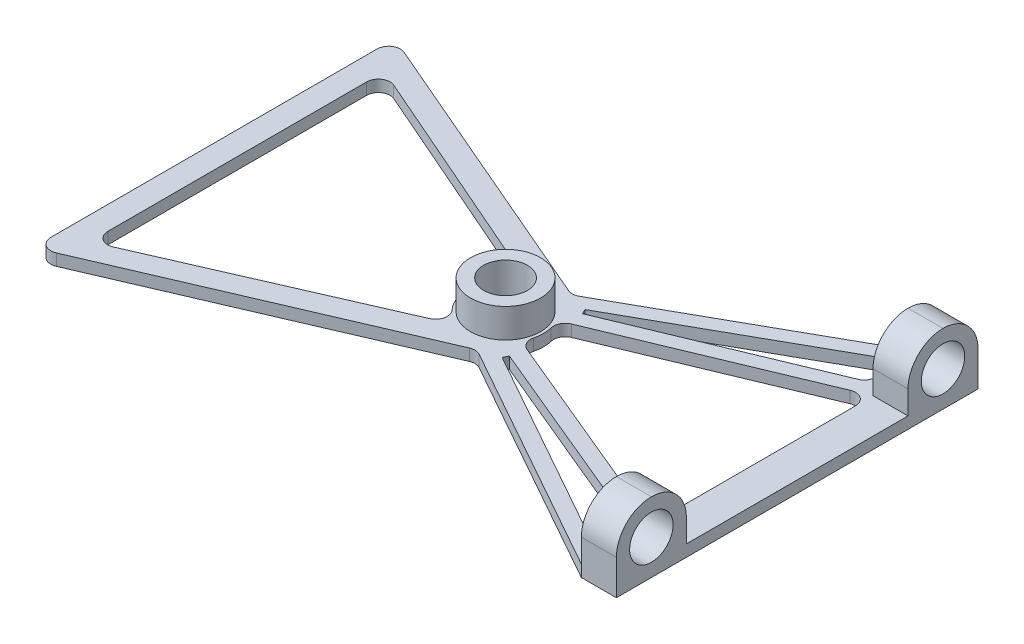
from build123d import *

# Parameters (mm, degrees)
SKETCH_1_W          = 100
SKETCH_1_H          = 100
EXTRUDE_1_DEPTH     = 2
SKETCH_2_W          = 6
SKETCH_2_H          = 12
EXTRUDE_2_DEPTH     = 10
SKETCH_3_R          = 3.725
CUT_EXTRUDE_1_DEPTH = 142.929559994
SKETCH_4_R          = 6
EXTRUDE_3_DEPTH     = 5
SKETCH_5_R          = 3.75
CUT_EXTRUDE_2_DEPTH = 142.594491418
SKETCH_6_W          = 100
SKETCH_6_H          = 19
CUT_EXTRUDE_3_DEPTH = 142.774468788
CUT_EXTRUDE_4_DEPTH = 130.077496102
FILLET_1_R          = 6
CUT_EXTRUDE_6_DEPTH = 130.077496102
FILLET_2_R          = 2
FILLET_3_R          = 2


# Some blends are built 0.0001 mm under size
with BuildPart() as part:
    # 草图1 → 凸台-拉伸1 (new body)
    with BuildSketch(Plane(origin=(0, 0, 0), x_dir=(1, 0, 0), z_dir=(0, 1, 0))):
        with Locations((50, -50)):
            Rectangle(SKETCH_1_W, SKETCH_1_H)
    extrude(amount=EXTRUDE_1_DEPTH)

    # 草图2 → 凸台-拉伸2 (add)
    with BuildSketch(Plane(origin=(0, 2, 0), x_dir=(1, 0, 0), z_dir=(0, 1, 0))):
        with Locations((97, -25)):
            Rectangle(SKETCH_2_W, SKETCH_2_H)
        with Locations((97, -75)):
            Rectangle(SKETCH_2_W, SKETCH_2_H)
    extrude(amount=EXTRUDE_2_DEPTH)

    # 草图3 → 切除-拉伸1 (cut, through all)
    with BuildSketch(Plane(origin=(100, 0, 0), x_dir=(0, 0, -1), z_dir=(1, 0, 0))):
        with Locations((-25, 6)):
            Circle(SKETCH_3_R)
        with Locations((-75, 6)):
            Circle(SKETCH_3_R)
    extrude(amount=-CUT_EXTRUDE_1_DEPTH, mode=Mode.SUBTRACT)

    # 草图4 → 凸台-拉伸3 (add)
    with BuildSketch(Plane(origin=(0, 2, 0), x_dir=(1, 0, 0), z_dir=(0, 1, 0))):
        with Locations(Location((50, -50, 0), (0, 0, 270))):
            Circle(SKETCH_4_R)
    extrude(amount=EXTRUDE_3_DEPTH)

    # 草图5 → 切除-拉伸2 (cut, through all)
    with BuildSketch(Plane(origin=(0, 7, 0), x_dir=(1, 0, 0), z_dir=(0, 1, 0))):
        with Locations(Location((50, -50, 0), (0, 0, 270))):
            Circle(SKETCH_5_R)
    extrude(amount=-CUT_EXTRUDE_2_DEPTH, mode=Mode.SUBTRACT)

    # 草图6 → 切除-拉伸3 (cut, through all)
    with BuildSketch(Plane(origin=(0, 2, 0), x_dir=(1, 0, 0), z_dir=(0, 1, 0))):
        with Locations((50, -90.5)):
            Rectangle(SKETCH_6_W, SKETCH_6_H)
        with Locations((50, -9.5)):
            Rectangle(SKETCH_6_W, SKETCH_6_H)
    extrude(amount=-CUT_EXTRUDE_3_DEPTH, mode=Mode.SUBTRACT)

    # 草图7 → 切除-拉伸4 (cut, through all)
    with BuildSketch(Plane(origin=(0, 2, 0), x_dir=(1, 0, 0), z_dir=(0, 1, 0))):
        with BuildLine():
            Line((55.73131114, -53.066279932), (94, -69))
            Line((94, -69), (94, -31))
            Line((94, -31), (55.73131114, -46.933720068))
            ThreePointArc((55.73131114, -46.933720068), (56.304899777, -48.41941821), (56.5, -50))
            ThreePointArc((56.5, -50), (56.304899777, -51.58058179), (55.73131114, -53.066279932))
        make_face()
        Polygon((0, -19), (53.212773637, -41.880071279), (94, -19), align=None)
        with BuildLine():
            Line((4, -75.253806127), (47.820913419, -56.123853499))
            ThreePointArc((47.820913419, -56.123853499), (43.5, -50), (47.820913419, -43.876146501))
            Line((47.820913419, -43.876146501), (4, -24.746193873))
            Line((4, -24.746193873), (4, -75.253806127))
        make_face()
        Polygon((94, -81), (53.212773637, -58.119928721), (0, -81), align=None)
    extrude(amount=-CUT_EXTRUDE_4_DEPTH, mode=Mode.SUBTRACT)

    # 圆角1
    fillet_1_edges = [part.edges().sort_by_distance(p)[0] for p in [
        (97, 12, 81),
        (97, 12, 69),
        (97, 12, 31),
        (97, 12, 19),
    ]]
    fillet(fillet_1_edges, radius=FILLET_1_R - 0.0001)  # a hair under: the kernel refuses the full size

    # 草图8 → 切除-拉伸6 (cut, through all)
    with BuildSketch(Plane(origin=(0, 2, 0), x_dir=(1, 0, 0), z_dir=(0, 1, 0))):
        Polygon((91.5, -23.268889447), (91.5, -29.332868234), (56.926900292, -43.727876504), (56.51218358, -42.895713945), align=None)
        Polygon((91.5, -70.667131766), (91.5, -76.731110553), (56.51218358, -57.104286055), (56.926900292, -56.272123496), align=None)
    extrude(amount=-CUT_EXTRUDE_6_DEPTH, mode=Mode.SUBTRACT)

    # 圆角2
    fillet_2_edges = [part.edges().sort_by_distance(p)[0] for p in [
        (47.820913419, 1, 43.876146501),
        (47.820913419, 1, 56.123853499),
        (55.73131114, 1, 53.066279932),
        (55.73131114, 1, 46.933720068),
    ]]
    fillet(fillet_2_edges, radius=FILLET_2_R)

    # 圆角3
    # the kernel refuses this fillet: 2 mm, written as the material it adds along each edge
    with BuildSketch(Plane(origin=(4, 2, 75.253806127), x_dir=(0, 0, -1), z_dir=(0, -1, 0)), Plane(origin=(4, 2, 24.746193873), x_dir=(0.9164772733710811, 0, 0.4000867498359684), z_dir=(0, -1, 0))) as fillet_3_piece_1:
        with BuildLine():
            CenterArc((FILLET_3_R * 1.52768299937, FILLET_3_R), FILLET_3_R, 156.416398259, 113.583601741)
            Line((FILLET_3_R * 0.611205725997, FILLET_3_R * 1.40008674984), (0, 0))
            Line((0, 0), (FILLET_3_R * 1.52768299937, 0))
        make_face()
    extrude(amount=2)
    with BuildSketch(Plane(origin=(53.212773637, 2, 58.119928721), x_dir=(-0.9186780925924477, 0, 0.39500704068497583), z_dir=(0, -1, 0))) as fillet_3_piece_2:
        with BuildLine():
            CenterArc((FILLET_3_R * 0.493765794488, -FILLET_3_R), FILLET_3_R, 90, 52.557168538)
            Line((-FILLET_3_R * 0.300194560291, -FILLET_3_R * 0.39203046537), (0, 0))
            Line((0, 0), (FILLET_3_R * 0.493765794488, 0))
        make_face()
    extrude(amount=2)
    with BuildSketch(Plane(origin=(53.212773637, 2, 41.880071279), x_dir=(-0.918678092592448, 0, -0.395007040684975), z_dir=(0, -1, 0))) as fillet_3_piece_3:
        with BuildLine():
            CenterArc((FILLET_3_R * 0.493765794488, FILLET_3_R), FILLET_3_R, 217.442831462, 52.557168538)
            Line((-FILLET_3_R * 0.300194560291, FILLET_3_R * 0.39203046537), (0, 0))
            Line((0, 0), (FILLET_3_R * 0.493765794488, 0))
        make_face()
    extrude(amount=2)
    with BuildSketch(Plane(origin=(91.5, 2, 23.268889447), x_dir=(-0.8721482225909527, 0, 0.48924173762204914), z_dir=(0, -1, 0))) as fillet_3_piece_4:
        with BuildLine():
            CenterArc((FILLET_3_R * 1.70755577899, -FILLET_3_R), FILLET_3_R, 90, 119.290755367)
            Line((FILLET_3_R * 0.8354075564, -FILLET_3_R * 1.48924173762), (0, 0))
            Line((0, 0), (FILLET_3_R * 1.70755577899, 0))
        make_face()
    extrude(amount=2)
    with BuildSketch(Plane(origin=(91.5, 2, 29.332868234), x_dir=(-0.9231759584436576, 0, 0.38437761348917576), z_dir=(0, -1, 0))) as fillet_3_piece_5:
        with BuildLine():
            CenterArc((FILLET_3_R * 0.666852706551, FILLET_3_R), FILLET_3_R, 202.605107184, 67.394892816)
            Line((-FILLET_3_R * 0.256323251893, FILLET_3_R * 0.615622386511), (0, 0))
            Line((0, 0), (FILLET_3_R * 0.666852706551, 0))
        make_face()
    extrude(amount=2)
    with BuildSketch(Plane(origin=(91.5, 2, 70.667131766), x_dir=(-0.923175958443657, 0, -0.38437761348917726), z_dir=(0, -1, 0))) as fillet_3_piece_6:
        with BuildLine():
            CenterArc((FILLET_3_R * 0.666852706551, -FILLET_3_R), FILLET_3_R, 90, 67.394892816)
            Line((-FILLET_3_R * 0.256323251893, -FILLET_3_R * 0.615622386511), (0, 0))
            Line((0, 0), (FILLET_3_R * 0.666852706551, 0))
        make_face()
    extrude(amount=2)
    with BuildSketch(Plane(origin=(91.5, 2, 76.731110553), x_dir=(-0.8721482225909533, 0, -0.4892417376220482), z_dir=(0, -1, 0))) as fillet_3_piece_7:
        with BuildLine():
            CenterArc((FILLET_3_R * 1.70755577899, FILLET_3_R), FILLET_3_R, 150.709244633, 119.290755367)
            Line((FILLET_3_R * 0.8354075564, FILLET_3_R * 1.48924173762), (0, 0))
            Line((0, 0), (FILLET_3_R * 1.70755577899, 0))
        make_face()
    extrude(amount=2)
    with BuildSketch(Plane(origin=(94, 2, 31), x_dir=(0, 0, 1), z_dir=(0, -1, 0)), Plane(origin=(94, 2, 69), x_dir=(-0.9231759584436573, 0, -0.3843776134891767), z_dir=(0, -1, 0))) as fillet_3_piece_8:
        with BuildLine():
            CenterArc((FILLET_3_R * 1.49958152704, FILLET_3_R), FILLET_3_R, 157.394892816, 112.605107184)
            Line((FILLET_3_R * 0.576405568596, FILLET_3_R * 1.38437761349), (0, 0))
            Line((0, 0), (FILLET_3_R * 1.49958152704, 0))
        make_face()
    extrude(amount=2)
    # the kernel refuses this fillet: 2 mm, written as the material it takes off along each edge
    with BuildSketch(Plane(origin=(0, 9.592469288, 81), x_dir=(0.9186780925924475, 0, -0.3950070406849762), z_dir=(0, -1, 0)), Plane(origin=(0, 9.592469288, 19), x_dir=(0, 0, 1), z_dir=(0, -1, 0))) as fillet_3_2_piece_1:
        with BuildLine():
            CenterArc((FILLET_3_R * 1.51849385757, -FILLET_3_R), FILLET_3_R, 90, 113.266413172)
            Line((FILLET_3_R * 0.599815764977, -FILLET_3_R * 1.39500704068), (0, 0))
            Line((0, 0), (FILLET_3_R * 1.51849385757, 0))
        make_face()
    extrude(amount=17.184938576, mode=Mode.SUBTRACT)


solid = part.part
